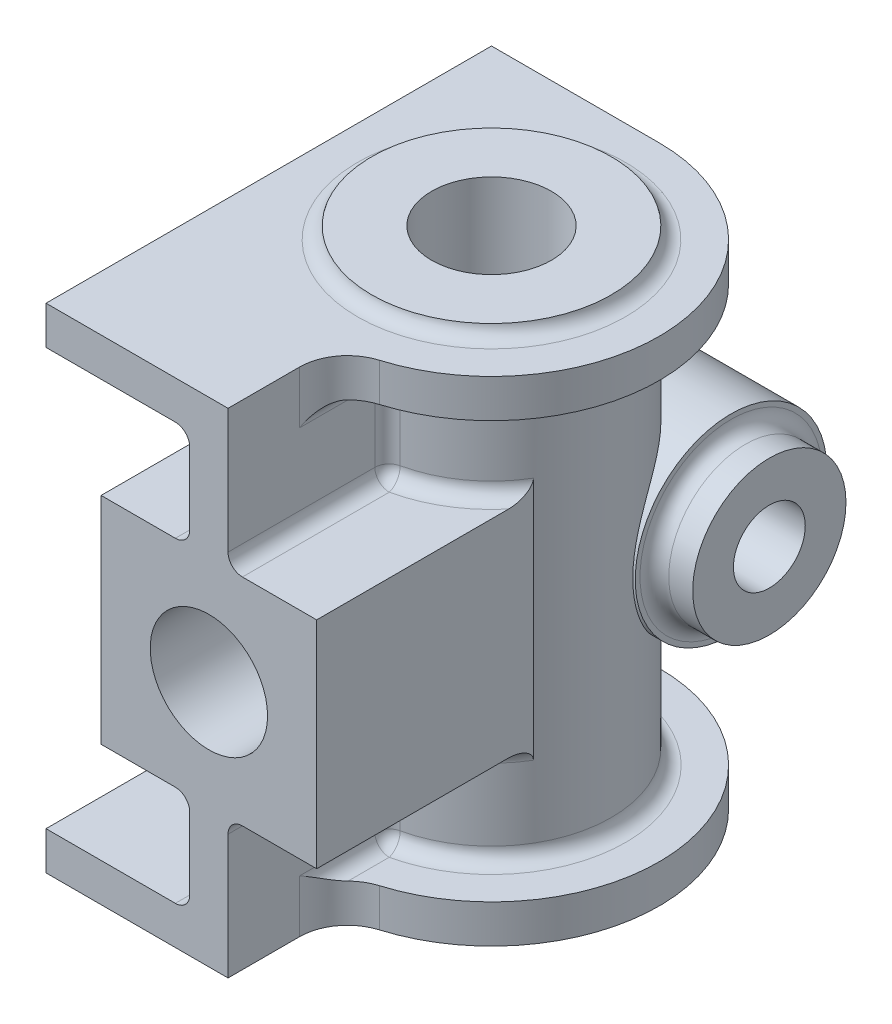
from build123d import *

# Parameters (mm, degrees)
SKETCH1_R                         = 35
SKETCH1_R_2                       = 25
SKETCH1_R_3                       = 12.5
BOSS_EXTRUDE1_DEPTH               = 103
SKETCH1_4_R                       = 25
SKETCH1_4_R_2                     = 12.5
BOSS_EXTRUDE2_DEPTH               = 105.5
SKETCH1_6_R                       = 35
SKETCH1_6_R_2                     = 25
CUT_EXTRUDE1_DEPTH                = 95
SKETCH1_7_R                       = 35
SKETCH1_7_R_2                     = 25
BOSS_EXTRUDE3_DEPTH               = 8
BOSS_EXTRUDE4_START               = 2.5
SKETCH1_8_R                       = 25
SKETCH1_8_R_2                     = 12.5
BOSS_EXTRUDE4_DEPTH               = 2.5
BOSS_EXTRUDE6_REACH               = 146.928
BOSS_EXTRUDE6_END_RADIUS          = 25
SKETCH2_W                         = 8
SKETCH2_H                         = 21
SKETCH2_H_2                       = 29
TAP_DRILL_FOR_M24_HELICOIL1_D     = 24.5
TAP_DRILL_FOR_M24_HELICOIL1_DEPTH = 20
TAP_DRILL_FOR_M24_HELICOIL1_TIP   = 7.360542583
F_22_0_22_DIAMETER_HOLE1_D        = 22
F_22_0_22_DIAMETER_HOLE1_DEPTH    = 32
F_22_0_22_DIAMETER_HOLE1_TIP      = 6.609466809
BOSS_EXTRUDE7_DEPTH               = 25
BOSS_EXTRUDE7_DEPTH_BACK          = 25
BOSS_EXTRUDE8_DEPTH               = 33
BOSS_EXTRUDE8_DEPTH_BACK          = 33
FILLET2_R                         = 3
FILLET3_R                         = 3
FILLET4_R                         = 3
FILLET5_START                     = -103
FILLET5_DEPTH                     = 8
FILLET5_START_2                   = -8
FILLET5_2_DEPTH                   = 8
FILLET5_START_3                   = 34.481879199
FILLET5_3_DEPTH                   = 8.599439358
FILLET5_START_4                   = -95
FILLET5_4_DEPTH                   = 3
FILLET5_START_5                   = -11.0000001
FILLET5_5_DEPTH                   = 3.0000001


with BuildPart() as part:
    # Sketch1 → Boss-Extrude1 (new body)
    # profile 1 of 5: a face of its own
    with BuildSketch(Plane(origin=(0, 0, 0), x_dir=(-1, 0, 0), z_dir=(0, 1, 0))):
        Circle(SKETCH1_R)
        Circle(SKETCH1_R_2, mode=Mode.SUBTRACT)
    # profile 2 of 5: a face of its own
    with BuildSketch(Plane(origin=(0, 0, 0), x_dir=(-1, 0, 0), z_dir=(0, 1, 0))):
        with BuildLine():
            ThreePointArc((5, 34.641016151), (26.457513111, 22.912878475), (35, 0))
            Line((35, 0), (35, 58))
            Line((35, 58), (5, 58))
            Line((5, 58), (5, 34.641016151))
        make_face()
    # profile 3 of 5: a face of its own
    with BuildSketch(Plane(origin=(0, 0, 0), x_dir=(-1, 0, 0), z_dir=(0, 1, 0))):
        with BuildLine():
            ThreePointArc((-3, 34.871191548), (1.006600804, 34.985522074), (5, 34.641016151))
            Line((5, 34.641016151), (5, 58))
            Line((5, 58), (-3, 58))
            Line((-3, 58), (-3, 34.871191548))
        make_face()
    # profile 4 of 5: a face of its own
    with BuildSketch(Plane(origin=(0, 0, 0), x_dir=(-1, 0, 0), z_dir=(0, 1, 0))):
        with BuildLine():
            Line((35, -35), (35, 0))
            ThreePointArc((35, 0), (24.748737342, -24.748737342), (0, -35))
            Line((0, -35), (35, -35))
        make_face()
    # profile 5 of 5: a face of its own
    with BuildSketch(Plane(origin=(0, 0, 0), x_dir=(-1, 0, 0), z_dir=(0, 1, 0))):
        Circle(SKETCH1_R_2)
        with Locations(Location((0, 0, 0), (0, 0, 90))):
            Circle(SKETCH1_R_3, mode=Mode.SUBTRACT)
    extrude(amount=-BOSS_EXTRUDE1_DEPTH)

    # Sketch1<4> → Boss-Extrude2 (add)
    with BuildSketch(Plane(origin=(0, 0, 0), x_dir=(-1, 0, 0), z_dir=(0, 1, 0))):
        with Locations(Location((0, 0, 0), (0, 0, 90))):
            Circle(SKETCH1_4_R)
        with Locations(Location((0, 0, 0), (0, 0, 90))):
            Circle(SKETCH1_4_R_2, mode=Mode.SUBTRACT)
    extrude(amount=-BOSS_EXTRUDE2_DEPTH)

    # Sketch1<6> → Cut-Extrude1 (cut)
    # profile 1 of 4: a face of its own
    with BuildSketch(Plane(origin=(0, 0, 0), x_dir=(-1, 0, 0), z_dir=(0, 1, 0))):
        with BuildLine():
            ThreePointArc((-3, 34.871191548), (1.006600804, 34.985522074), (5, 34.641016151))
            Line((5, 34.641016151), (5, 58))
            Line((5, 58), (-3, 58))
            Line((-3, 58), (-3, 34.871191548))
        make_face()
    # profile 2 of 4: a face of its own
    with BuildSketch(Plane(origin=(0, 0, 0), x_dir=(-1, 0, 0), z_dir=(0, 1, 0))):
        with BuildLine():
            ThreePointArc((5, 34.641016151), (26.457513111, 22.912878475), (35, 0))
            Line((35, 0), (35, 58))
            Line((35, 58), (5, 58))
            Line((5, 58), (5, 34.641016151))
        make_face()
    # profile 3 of 4: a face of its own
    with BuildSketch(Plane(origin=(0, 0, 0), x_dir=(-1, 0, 0), z_dir=(0, 1, 0))):
        with BuildLine():
            Line((35, -35), (35, 0))
            ThreePointArc((35, 0), (24.748737342, -24.748737342), (0, -35))
            Line((0, -35), (35, -35))
        make_face()
    # profile 4 of 4: a face of its own
    with BuildSketch(Plane(origin=(0, 0, 0), x_dir=(-1, 0, 0), z_dir=(0, 1, 0))):
        Circle(SKETCH1_6_R)
        with Locations(Location((0, 0, 0), (0, 0, 90))):
            Circle(SKETCH1_6_R_2, mode=Mode.SUBTRACT)
    extrude(amount=-CUT_EXTRUDE1_DEPTH, mode=Mode.SUBTRACT)

    # Sketch1<7> → Boss-Extrude3 (add)
    # profile 1 of 4: a face of its own
    with BuildSketch(Plane(origin=(0, 0, 0), x_dir=(-1, 0, 0), z_dir=(0, 1, 0))):
        Circle(SKETCH1_7_R)
        with Locations(Location((0, 0, 0), (0, 0, 90))):
            Circle(SKETCH1_7_R_2, mode=Mode.SUBTRACT)
    # profile 2 of 4: a face of its own
    with BuildSketch(Plane(origin=(0, 0, 0), x_dir=(-1, 0, 0), z_dir=(0, 1, 0))):
        with BuildLine():
            ThreePointArc((-3, 34.871191548), (1.006600804, 34.985522074), (5, 34.641016151))
            Line((5, 34.641016151), (5, 58))
            Line((5, 58), (-3, 58))
            Line((-3, 58), (-3, 34.871191548))
        make_face()
    # profile 3 of 4: a face of its own
    with BuildSketch(Plane(origin=(0, 0, 0), x_dir=(-1, 0, 0), z_dir=(0, 1, 0))):
        with BuildLine():
            ThreePointArc((5, 34.641016151), (26.457513111, 22.912878475), (35, 0))
            Line((35, 0), (35, 58))
            Line((35, 58), (5, 58))
            Line((5, 58), (5, 34.641016151))
        make_face()
    # profile 4 of 4: a face of its own
    with BuildSketch(Plane(origin=(0, 0, 0), x_dir=(-1, 0, 0), z_dir=(0, 1, 0))):
        with BuildLine():
            Line((35, -35), (35, 0))
            ThreePointArc((35, 0), (24.748737342, -24.748737342), (0, -35))
            Line((0, -35), (35, -35))
        make_face()
    extrude(amount=-BOSS_EXTRUDE3_DEPTH)

    # Sketch1<8> → Boss-Extrude4 (add)
    with BuildSketch(Plane(origin=(0, 0, 0), x_dir=(-1, 0, 0), z_dir=(0, 1, 0)).offset(BOSS_EXTRUDE4_START)):
        with Locations(Location((0, 0, 0), (0, 0, 90))):
            Circle(SKETCH1_8_R)
        with Locations(Location((0, 0, 0), (0, 0, 90))):
            Circle(SKETCH1_8_R_2, mode=Mode.SUBTRACT)
    extrude(amount=-BOSS_EXTRUDE4_DEPTH)

    # Boss-Extrude6: up to this cylinder (the profile starts outside it)
    boss_extrude6_end = Plane(origin=(0, -49.5, 0), z_dir=(0, 1, 0)) * Cylinder(BOSS_EXTRUDE6_END_RADIUS, 414.856, mode=Mode.PRIVATE)
    # Sketch2 → Boss-Extrude6 (add, up to the surface)
    with BuildSketch(Plane.XY.offset(58), mode=Mode.PRIVATE) as boss_extrude6_sk1:
        with BuildLine():
            Line((3, -61.746950766), (3, -74))
            Line((3, -74), (21.5, -74))
            Line((21.5, -74), (21.5, -29))
            Line((21.5, -29), (3, -29))
            Line((3, -29), (3, -41.253049234))
            ThreePointArc((3, -41.253049234), (8.082951062, -45.295163177), (10, -51.5))
            ThreePointArc((10, -51.5), (8.082951062, -57.704836823), (3, -61.746950766))
        make_face()
    boss_extrude6_tool1 = extrude(boss_extrude6_sk1.sketch, amount=-BOSS_EXTRUDE6_REACH, mode=Mode.PRIVATE) - boss_extrude6_end
    add(boss_extrude6_tool1.solids().sort_by_distance((13.157848, -51.5, 58))[0])
    # Sketch2 → Boss-Extrude6 (add, up to the surface)
    with BuildSketch(Plane.XY.offset(58), mode=Mode.PRIVATE) as boss_extrude6_sk2:
        with BuildLine():
            Line((-5, -74), (3, -74))
            Line((3, -74), (3, -61.746950766))
            ThreePointArc((3, -61.746950766), (-1, -62.5), (-5, -61.746950766))
            Line((-5, -61.746950766), (-5, -74))
        make_face()
    boss_extrude6_tool2 = extrude(boss_extrude6_sk2.sketch, amount=-BOSS_EXTRUDE6_REACH, mode=Mode.PRIVATE) - boss_extrude6_end
    add(boss_extrude6_tool2.solids().sort_by_distance((-1, -68.124139, 58))[0])
    # Sketch2 → Boss-Extrude6 (add, up to the surface)
    with BuildSketch(Plane.XY.offset(58), mode=Mode.PRIVATE) as boss_extrude6_sk3:
        with BuildLine():
            Line((-23.5, -74), (-5, -74))
            Line((-5, -74), (-5, -61.746950766))
            ThreePointArc((-5, -61.746950766), (-12, -51.5), (-5, -41.253049234))
            Line((-5, -41.253049234), (-5, -29))
            Line((-5, -29), (-23.5, -29))
            Line((-23.5, -29), (-23.5, -74))
        make_face()
    boss_extrude6_tool3 = extrude(boss_extrude6_sk3.sketch, amount=-BOSS_EXTRUDE6_REACH, mode=Mode.PRIVATE) - boss_extrude6_end
    add(boss_extrude6_tool3.solids().sort_by_distance((-15.157848, -51.5, 58))[0])
    # Sketch2 → Boss-Extrude6 (add, up to the surface)
    with BuildSketch(Plane.XY.offset(58), mode=Mode.PRIVATE) as boss_extrude6_sk4:
        with BuildLine():
            ThreePointArc((-5, -61.746950766), (-1, -62.5), (3, -61.746950766))
            Line((3, -61.746950766), (3, -41.253049234))
            ThreePointArc((3, -41.253049234), (-1, -40.5), (-5, -41.253049234))
            Line((-5, -41.253049234), (-5, -61.746950766))
        make_face()
    boss_extrude6_tool4 = extrude(boss_extrude6_sk4.sketch, amount=-BOSS_EXTRUDE6_REACH, mode=Mode.PRIVATE) - boss_extrude6_end
    add(boss_extrude6_tool4.solids().sort_by_distance((-1, -51.5, 58))[0])
    # Sketch2 → Boss-Extrude6 (add, up to the surface)
    with BuildSketch(Plane.XY.offset(58), mode=Mode.PRIVATE) as boss_extrude6_sk5:
        with BuildLine():
            Line((3, -41.253049234), (3, -61.746950766))
            ThreePointArc((3, -61.746950766), (8.082951062, -57.704836823), (10, -51.5))
            ThreePointArc((10, -51.5), (8.082951062, -45.295163177), (3, -41.253049234))
        make_face()
    boss_extrude6_tool5 = extrude(boss_extrude6_sk5.sketch, amount=-BOSS_EXTRUDE6_REACH, mode=Mode.PRIVATE) - boss_extrude6_end
    add(boss_extrude6_tool5.solids().sort_by_distance((5.893926, -51.5, 58))[0])
    # Sketch2 → Boss-Extrude6 (add, up to the surface)
    with BuildSketch(Plane.XY.offset(58), mode=Mode.PRIVATE) as boss_extrude6_sk6:
        with BuildLine():
            ThreePointArc((-5, -41.253049234), (-12, -51.5), (-5, -61.746950766))
            Line((-5, -61.746950766), (-5, -41.253049234))
        make_face()
    boss_extrude6_tool6 = extrude(boss_extrude6_sk6.sketch, amount=-BOSS_EXTRUDE6_REACH, mode=Mode.PRIVATE) - boss_extrude6_end
    add(boss_extrude6_tool6.solids().sort_by_distance((-7.893926, -51.5, 58))[0])
    # Sketch2 → Boss-Extrude6 (add, up to the surface)
    with BuildSketch(Plane.XY.offset(58), mode=Mode.PRIVATE) as boss_extrude6_sk7:
        with BuildLine():
            ThreePointArc((-5, -41.253049234), (-1, -40.5), (3, -41.253049234))
            Line((3, -41.253049234), (3, -29))
            Line((3, -29), (-5, -29))
            Line((-5, -29), (-5, -41.253049234))
        make_face()
    boss_extrude6_tool7 = extrude(boss_extrude6_sk7.sketch, amount=-BOSS_EXTRUDE6_REACH, mode=Mode.PRIVATE) - boss_extrude6_end
    add(boss_extrude6_tool7.solids().sort_by_distance((-1, -34.875861, 58))[0])
    # Sketch2 → Boss-Extrude6 (add, up to the surface)
    with BuildSketch(Plane.XY.offset(58), mode=Mode.PRIVATE) as boss_extrude6_sk8:
        with Locations((-1, -84.5)):
            Rectangle(SKETCH2_W, SKETCH2_H)
    boss_extrude6_tool8 = extrude(boss_extrude6_sk8.sketch, amount=-BOSS_EXTRUDE6_REACH, mode=Mode.PRIVATE) - boss_extrude6_end
    add(boss_extrude6_tool8.solids().sort_by_distance((-1, -84.5, 58))[0])
    # Sketch2 → Boss-Extrude6 (add, up to the surface)
    with BuildSketch(Plane.XY.offset(58), mode=Mode.PRIVATE) as boss_extrude6_sk9:
        with Locations((-1, -14.5)):
            Rectangle(SKETCH2_W, SKETCH2_H_2)
    boss_extrude6_tool9 = extrude(boss_extrude6_sk9.sketch, amount=-BOSS_EXTRUDE6_REACH, mode=Mode.PRIVATE) - boss_extrude6_end
    add(boss_extrude6_tool9.solids().sort_by_distance((-1, -14.5, 58))[0])

    # Tap Drill for M24 Helicoil1
    with Locations(Plane.XY.offset(58)):
        with Locations((-1, -51.5)):
            Hole(TAP_DRILL_FOR_M24_HELICOIL1_D / 2, depth=TAP_DRILL_FOR_M24_HELICOIL1_DEPTH)
            with Locations((0, 0, -(TAP_DRILL_FOR_M24_HELICOIL1_DEPTH + TAP_DRILL_FOR_M24_HELICOIL1_TIP / 2))):  # 118° drill point
                Cone(0, TAP_DRILL_FOR_M24_HELICOIL1_D / 2, TAP_DRILL_FOR_M24_HELICOIL1_TIP, mode=Mode.SUBTRACT)

    # Ø22.0 (22) Diameter Hole1
    with Locations(Plane.XY.offset(58)):
        with Locations((-1, -51.5)):
            Hole(F_22_0_22_DIAMETER_HOLE1_D / 2, depth=F_22_0_22_DIAMETER_HOLE1_DEPTH)
            with Locations((0, 0, -(F_22_0_22_DIAMETER_HOLE1_DEPTH + F_22_0_22_DIAMETER_HOLE1_TIP / 2))):  # 118° drill point
                Cone(0, F_22_0_22_DIAMETER_HOLE1_D / 2, F_22_0_22_DIAMETER_HOLE1_TIP, mode=Mode.SUBTRACT)

    # Sketch10 → Boss-Extrude7 (add, two sides: drawn at the far end of the back side and taken through both)
    with BuildSketch(Plane.YZ.offset(-BOSS_EXTRUDE7_DEPTH_BACK)):
        with BuildLine():
            ThreePointArc((-67.5, -25), (-51.5, -9), (-35.5, -25))
            Line((-35.5, -25), (-31.5, -25))
            ThreePointArc((-31.5, -25), (-51.5, -5), (-71.5, -25))
            Line((-71.5, -25), (-67.5, -25))
        make_face()
        with BuildLine():
            Line((-31.5, -25), (-35.5, -25))
            ThreePointArc((-35.5, -25), (-51.5, -41), (-67.5, -25))
            Line((-67.5, -25), (-71.5, -25))
            ThreePointArc((-71.5, -25), (-51.5, -45), (-31.5, -25))
        make_face()
        with BuildLine():
            ThreePointArc((-59, -25), (-51.5, -17.5), (-44, -25))
            Line((-44, -25), (-35.5, -25))
            ThreePointArc((-35.5, -25), (-51.5, -9), (-67.5, -25))
            Line((-67.5, -25), (-59, -25))
        make_face()
        with BuildLine():
            Line((-35.5, -25), (-44, -25))
            ThreePointArc((-44, -25), (-51.5, -32.5), (-59, -25))
            Line((-59, -25), (-67.5, -25))
            ThreePointArc((-67.5, -25), (-51.5, -41), (-35.5, -25))
        make_face()
        with BuildLine():
            ThreePointArc((-59, -25), (-51.5, -17.5), (-44, -25))
            Line((-44, -25), (-35.5, -25))
            ThreePointArc((-35.5, -25), (-51.5, -9), (-67.5, -25))
            Line((-67.5, -25), (-59, -25))
        make_face()
        with BuildLine():
            Line((-35.5, -25), (-44, -25))
            ThreePointArc((-44, -25), (-51.5, -32.5), (-59, -25))
            Line((-59, -25), (-67.5, -25))
            ThreePointArc((-67.5, -25), (-51.5, -41), (-35.5, -25))
        make_face()
        with BuildLine():
            ThreePointArc((-67.5, -25), (-51.5, -9), (-35.5, -25))
            Line((-35.5, -25), (-31.5, -25))
            ThreePointArc((-31.5, -25), (-51.5, -5), (-71.5, -25))
            Line((-71.5, -25), (-67.5, -25))
        make_face()
        with BuildLine():
            Line((-31.5, -25), (-35.5, -25))
            ThreePointArc((-35.5, -25), (-51.5, -41), (-67.5, -25))
            Line((-67.5, -25), (-71.5, -25))
            ThreePointArc((-71.5, -25), (-51.5, -45), (-31.5, -25))
        make_face()
    extrude(amount=BOSS_EXTRUDE7_DEPTH + BOSS_EXTRUDE7_DEPTH_BACK)

    # Sketch10<5> → Boss-Extrude8 (add, two sides: drawn at the far end of the back side and taken through both)
    with BuildSketch(Plane.YZ.offset(-BOSS_EXTRUDE8_DEPTH_BACK)):
        with BuildLine():
            ThreePointArc((-59, -25), (-51.5, -17.5), (-44, -25))
            Line((-44, -25), (-35.5, -25))
            ThreePointArc((-35.5, -25), (-51.5, -9), (-67.5, -25))
            Line((-67.5, -25), (-59, -25))
        make_face()
        with BuildLine():
            Line((-35.5, -25), (-44, -25))
            ThreePointArc((-44, -25), (-51.5, -32.5), (-59, -25))
            Line((-59, -25), (-67.5, -25))
            ThreePointArc((-67.5, -25), (-51.5, -41), (-35.5, -25))
        make_face()
        with BuildLine():
            ThreePointArc((-59, -25), (-51.5, -17.5), (-44, -25))
            Line((-44, -25), (-35.5, -25))
            ThreePointArc((-35.5, -25), (-51.5, -9), (-67.5, -25))
            Line((-67.5, -25), (-59, -25))
        make_face()
        with BuildLine():
            Line((-35.5, -25), (-44, -25))
            ThreePointArc((-44, -25), (-51.5, -32.5), (-59, -25))
            Line((-59, -25), (-67.5, -25))
            ThreePointArc((-67.5, -25), (-51.5, -41), (-35.5, -25))
        make_face()
    extrude(amount=BOSS_EXTRUDE8_DEPTH + BOSS_EXTRUDE8_DEPTH_BACK)

    # Fillet2
    fillet2_edges = [part.edges().sort_by_distance(p)[0] for p in [
        (25, -67.5, -25),
        (-25, -67.5, -25),
    ]]
    fillet(fillet2_edges, radius=FILLET2_R)

    # Fillet3
    # the kernel refuses this fillet: 3 mm, written as the material it adds along each edge
    with BuildSketch(Plane(origin=(0, -103, 0), x_dir=(0, 0, 1), z_dir=(-1, 0, 0))) as fillet3_piece_1:
        with BuildLine():
            CenterArc((27.958039892, -3), FILLET3_R, 90, 80.405931773)
            Line((25, -2.5), (24.940839202, -2.49))
            ThreePointArc((24.940839202, -2.49), (24.94, -1.25), (24.94, 0))
            Line((24.94, 0), (25, 0.06))
            Line((25, 0.06), (27.958039892, 0.06))
            Line((27.958039892, 0.06), (27.958039892, 0))
        make_face()
    revolve(axis=Axis((0, -103, 0), (0, 1, 0)))
    with BuildSketch(Plane(origin=(0, 0, 0), x_dir=(0, 0, 1), z_dir=(1, 0, 0))) as fillet3_piece_2:
        with BuildLine():
            CenterArc((27.958039892, -3), FILLET3_R, 90, 80.405931773)
            Line((25, -2.5), (24.940839202, -2.49))
            ThreePointArc((24.940839202, -2.49), (24.94, -1.25), (24.94, 0))
            Line((24.94, 0), (25, 0.06))
            Line((25, 0.06), (27.958039892, 0.06))
            Line((27.958039892, 0.06), (27.958039892, 0))
        make_face()
    revolve(axis=Axis((0, 0, 0), (0, -1, 0)))

    # Fillet4
    fillet4_edges = [part.edges().sort_by_distance(p)[0] for p in [
        (1.013073012, -95, -24.979465228),
        (1.013073012, -8, -24.979465228),
        (-5, -8, 41.247448714),
        (3, -84.5, 24.819347292),
        (-16.333618335, -29, 18.926513469),
        (3, -18.5, 24.819347292),
        (13.654136359, -29, 20.94193306),
        (3, -29, 41.409673646),
        (13.654136359, -74, 20.94193306),
        (3, -74, 41.409673646),
        (-5, -84.5, 24.494897428),
        (-5, -95, 41.247448714),
        (-16.333618335, -74, 18.926513469),
        (-5, -74, 41.247448714),
        (-5, -18.5, 24.494897428),
        (-5, -29, 41.247448714),
        (3, -8, 29.84526942),
        (3, -95, 29.84526942),
    ]]
    fillet(fillet4_edges, radius=FILLET4_R)

    # Fillet5: read off the stored shape, not the designer's step
    # Fillet5 outline → Fillet5 (add)
    with BuildSketch(Plane(origin=(0, 0, 0), x_dir=(1, 0, 0), z_dir=(0, 1, 0)).offset(FILLET5_START)):
        with BuildLine():
            ThreePointArc((3, -43.081318457), (4.972270281, -37.118470517), (10.111111111, -33.507692133))
            ThreePointArc((10.111111111, -33.507692133), (6.590908386, -34.373826186), (2.999997236, -34.871191786))
            Line((2.999997236, -34.871191786), (3, -43.081318457))
        make_face()
    extrude(amount=FILLET5_DEPTH)

    # Fillet5 2 outline → Fillet5 2 (add)
    with BuildSketch(Plane(origin=(0, 0, 0), x_dir=(1, 0, 0), z_dir=(0, 1, 0)).offset(FILLET5_START_2)):
        with BuildLine():
            ThreePointArc((3, -43.081318457), (4.972270281, -37.118470517), (10.111111111, -33.507692133))
            ThreePointArc((10.111111111, -33.507692133), (6.590908386, -34.373826186), (2.999997236, -34.871191786))
            Line((2.999997236, -34.871191786), (3, -43.081318457))
        make_face()
    extrude(amount=FILLET5_2_DEPTH)

    # Fillet5 3 outline → Fillet5 3 (add)
    with BuildSketch(Plane.XY.offset(FILLET5_START_3)):
        with BuildLine():
            Line((3, -95), (6, -95))
            ThreePointArc((6, -95), (3.878679656, -94.121320344), (3, -92))
            Line((3, -92), (3, -95))
        make_face()
        with BuildLine():
            ThreePointArc((3, -11), (3.878679656, -8.878679656), (6, -8))
            Line((6, -8), (3, -8))
            Line((3, -8), (3, -11))
        make_face()
    extrude(amount=FILLET5_3_DEPTH)

    # Fillet5 4 outline → Fillet5 4 (cut)
    with BuildSketch(Plane(origin=(0, 0, 0), x_dir=(1, 0, 0), z_dir=(0, 1, 0)).offset(FILLET5_START_4)):
        with BuildLine():
            ThreePointArc((6, -35.939890029), (3.780455543, -39.208335111), (3, -43.081318457))
            Line((3, -43.081318457), (6, -43.081318557))
            Line((6, -43.081318557), (6, -35.939890029))
        make_face()
    extrude(amount=FILLET5_4_DEPTH, mode=Mode.SUBTRACT)

    # Fillet5 5 outline → Fillet5 5 (cut)
    with BuildSketch(Plane(origin=(0, 0, 0), x_dir=(1, 0, 0), z_dir=(0, 1, 0)).offset(FILLET5_START_5)):
        with BuildLine():
            ThreePointArc((6, -35.939890029), (3.780455543, -39.208335111), (3, -43.081318457))
            Line((3, -43.081318457), (6, -43.081318557))
            Line((6, -43.081318557), (6, -35.939890029))
        make_face()
    extrude(amount=FILLET5_5_DEPTH, mode=Mode.SUBTRACT)


solid = part.part
